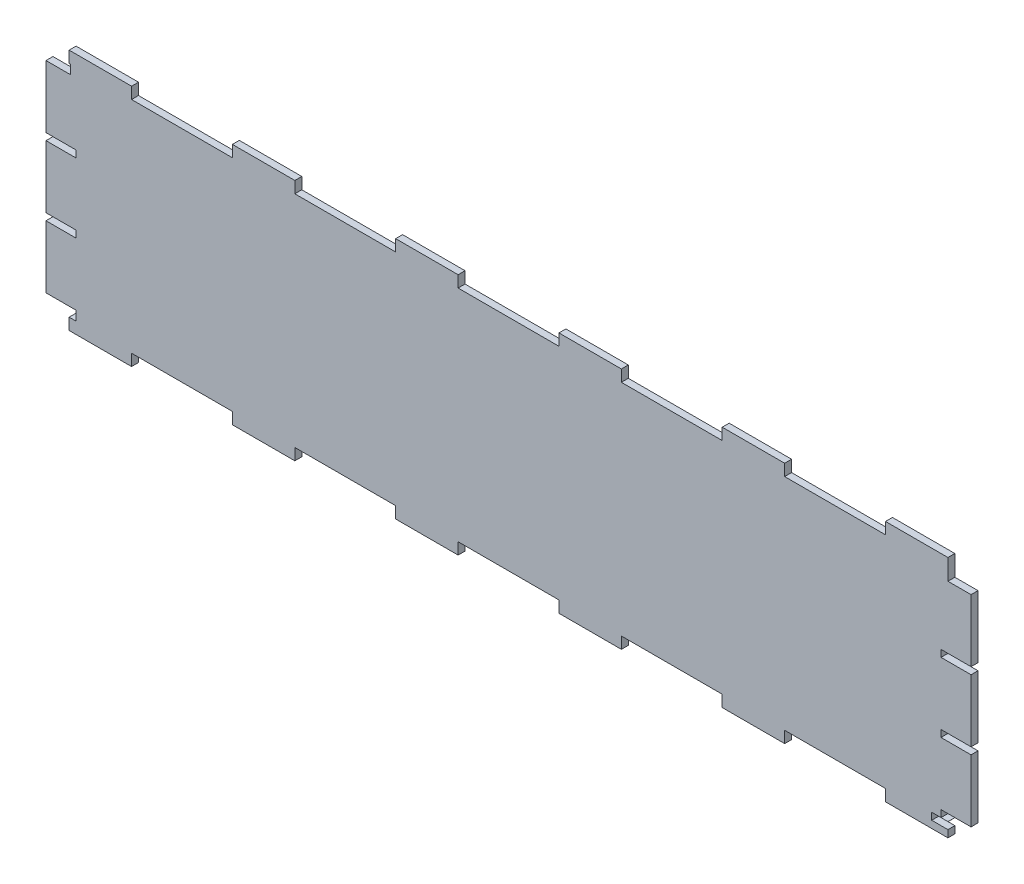
from build123d import *

# Parameters (mm, degrees)
BOSS_EXTRUDE1_DEPTH = 3
SKETCH3_W           = 27
SKETCH3_H           = 5
BOSS_EXTRUDE2_DEPTH = 3
SKETCH4_W           = 8
SKETCH4_H           = 3
CUT_EXTRUDE1_DEPTH  = 3
SKETCH5_W           = 5
SKETCH5_H           = 3.9
CUT_EXTRUDE2_DEPTH  = 3
SKETCH6_W           = 5
SKETCH6_H           = 4.739085619
CUT_EXTRUDE3_DEPTH  = 3
SKETCH7_W           = 7
SKETCH7_H           = 3
CUT_EXTRUDE5_DEPTH  = 3
SKETCH8_W           = 4.245961236
SKETCH8_H           = 1.503952676
CUT_EXTRUDE6_DEPTH  = 10


# Read off the part's stored shape, not the designer's step: Boss-Extrude1
with BuildPart() as part:
    # Boss-Extrude1 outline → Boss-Extrude1 (new body)
    with BuildSketch(Plane.XY):
        Polygon((195, -43.4), (200, -43.4), (200, -16.4), (195, -16.4), (195, -13.4), (200, -13.4), (200, 13.6), (195, 13.6), (195, 16.6), (200, 16.6), (200, 43.6), (195, 43.6), (195, 47.5), (190, 47.5), (190, 52.5), (163, 52.5), (163, 47.5), (119.4, 47.5), (119.4, 52.5), (92.4, 52.5), (92.4, 47.5), (48.8, 47.5), (48.8, 52.5), (21.8, 52.5), (21.8, 47.5), (-21.8, 47.5), (-21.8, 52.5), (-48.8, 52.5), (-48.8, 47.5), (-92.4, 47.5), (-92.4, 52.5), (-119.4, 52.5), (-119.4, 47.5), (-163, 47.5), (-163, 52.5), (-190, 52.5), (-190, 47.5), (-189.5, 47.5), (-189.5, 43.6), (-200, 43.6), (-200, 16.6), (-187, 16.6), (-187, 13.6), (-200, 13.6), (-200, -13.4), (-187, -13.4), (-187, -16.4), (-200, -16.4), (-200, -43.4), (-187, -43.4), (-187, -47.5), (195, -47.5), align=None)
    extrude(amount=BOSS_EXTRUDE1_DEPTH)

    # Sketch3 → Boss-Extrude2 (add)
    with BuildSketch(Plane.XY.offset(3)):
        with Locations((-176.5, -50)):
            Rectangle(SKETCH3_W, SKETCH3_H)
        with Locations((-105.9, -50)):
            Rectangle(SKETCH3_W, SKETCH3_H)
        with Locations((-35.3, -50)):
            Rectangle(SKETCH3_W, SKETCH3_H)
        with Locations((35.3, -50)):
            Rectangle(SKETCH3_W, SKETCH3_H)
        with Locations((105.9, -50)):
            Rectangle(SKETCH3_W, SKETCH3_H)
        with Locations((176.5, -50)):
            Rectangle(SKETCH3_W, SKETCH3_H)
    extrude(amount=-BOSS_EXTRUDE2_DEPTH)

    # Sketch4 → Cut-Extrude1 (cut)
    with BuildSketch(Plane.XY.offset(3)):
        with Locations((191, -14.9)):
            Rectangle(SKETCH4_W, SKETCH4_H)
        with Locations((191, 15.1)):
            Rectangle(SKETCH4_W, SKETCH4_H)
        with Locations((191, -44.9)):
            Rectangle(SKETCH4_W, SKETCH4_H)
    extrude(amount=-CUT_EXTRUDE1_DEPTH, mode=Mode.SUBTRACT)

    # Sketch5 → Cut-Extrude2 (cut)
    with BuildSketch(Plane.XY.offset(3)):
        with Locations((192.5, 45.55)):
            Rectangle(SKETCH5_W, SKETCH5_H)
    extrude(amount=-CUT_EXTRUDE2_DEPTH, mode=Mode.SUBTRACT)

    # Sketch6 → Cut-Extrude3 (cut)
    with BuildSketch(Plane.XY.offset(3)):
        with Locations((192.522405585, -47.571722604)):
            Rectangle(SKETCH6_W, SKETCH6_H)
    extrude(amount=-CUT_EXTRUDE3_DEPTH, mode=Mode.SUBTRACT)

    # Sketch7 → Cut-Extrude5 (cut)
    with BuildSketch(Plane.XY.offset(3)):
        with Locations((186.5, -47.902198406)):
            Rectangle(SKETCH7_W, SKETCH7_H)
    extrude(amount=-CUT_EXTRUDE5_DEPTH, mode=Mode.SUBTRACT)

    # Sketch8 → Cut-Extrude6 (cut)
    with BuildSketch(Plane.XY.offset(3)):
        with Locations((189.30979268, -47.154174744)):
            Rectangle(SKETCH8_W, SKETCH8_H)
    extrude(amount=-CUT_EXTRUDE6_DEPTH, mode=Mode.SUBTRACT)


solid = part.part
